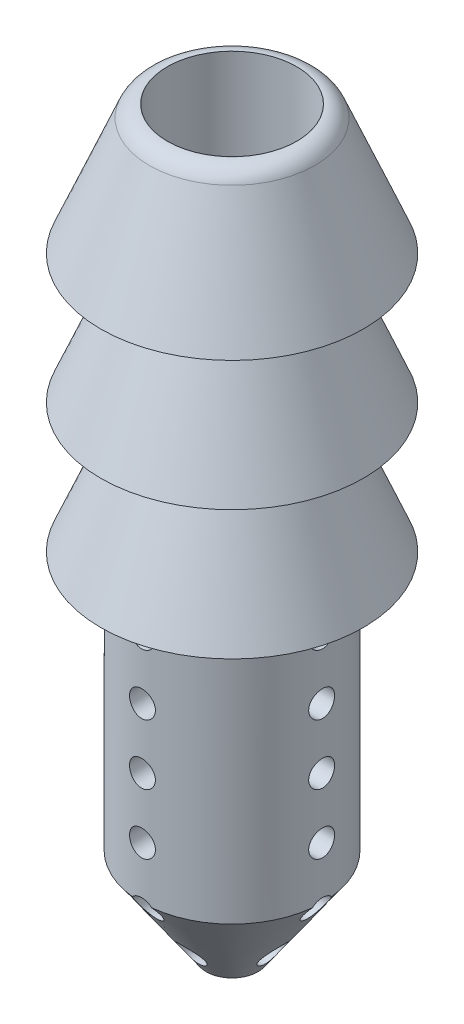
from build123d import *

# Parameters (mm, degrees)
SKETCH1_R                   = 5.08
BOSS_EXTRUDE1_DEPTH         = 5
BOSS_EXTRUDE1_TAPER         = 22.5
LPATTERN1_COUNT             = 3
LPATTERN1_PITCH             = 5
SKETCH3_R                   = 3.5
SKETCH3_R_2                 = 2.5
BOSS_EXTRUDE2_DEPTH         = 10
SKETCH5_R                   = 0.5
CUT_EXTRUDE1_DEPTH          = 27.011781985
LPATTERN2_COUNT             = 7
LPATTERN2_PITCH             = 2.333333333
CIRPATTERN1_COUNT           = 2
CIRPATTERN1_ANGLE           = 90
CIRPATTERN1_COPY_1_SKETCH_R = 0.5
CIRPATTERN1_COPY_1_DEPTH    = 27.011781985
CIRPATTERN1_COPY_2_SKETCH_R = 0.5
CIRPATTERN1_COPY_2_DEPTH    = 27.011781985
CIRPATTERN1_COPY_3_SKETCH_R = 0.5
CIRPATTERN1_COPY_3_DEPTH    = 27.011781985
CIRPATTERN1_COPY_4_SKETCH_R = 0.5
CIRPATTERN1_COPY_4_DEPTH    = 27.011781985
CIRPATTERN1_COPY_5_SKETCH_R = 0.5
CIRPATTERN1_COPY_5_DEPTH    = 27.011781985
CIRPATTERN1_COPY_6_SKETCH_R = 0.5
CIRPATTERN1_COPY_6_DEPTH    = 27.011781985
CUT_EXTRUDE2_START          = -15
SKETCH6_R                   = 2.5
CUT_EXTRUDE2_DEPTH          = 15
SKETCH7_R                   = 1
CUT_EXTRUDE3_DEPTH          = 31.848222121
CHAMFER1_SIZE               = 0.574025149
CHAMFER1_SIZE_2             = 0.75
FILLET1_R                   = 0.75


with BuildPart() as part:
    # Sketch1 → Boss-Extrude1 (new body)
    with BuildSketch(Plane(origin=(0, 0, 0), x_dir=(1, 0, 0), z_dir=(0, 1, 0))):
        Circle(SKETCH1_R)
    boss_extrude1 = extrude(amount=BOSS_EXTRUDE1_DEPTH, taper=BOSS_EXTRUDE1_TAPER)

    # LPattern1: Boss-Extrude1 ×3
    with Locations(*[(0, -i * LPATTERN1_PITCH, 0) for i in range(1, LPATTERN1_COUNT)]):
        add(boss_extrude1)

    # Sketch3 → Boss-Extrude2 (add)
    with BuildSketch(Plane.XZ.offset(10)):
        with Locations(Location((0, 0, 0), (0, 0, 90))):
            Circle(SKETCH3_R)
        with Locations(Location((0, 0, 0), (0, 0, 270))):
            Circle(SKETCH3_R_2, mode=Mode.SUBTRACT)
    extrude(amount=BOSS_EXTRUDE2_DEPTH)

    # Sketch4 → Revolve2 (revolve)
    with BuildSketch(Plane(origin=(0, 0, 0), x_dir=(0, 0, -1), z_dir=(1, 0, 0))):
        Polygon((-2.5, -20), (-3.5, -20), (0, -25), (0, -23.571428571), align=None)
    revolve(axis=Axis((0, 0, 0), (0, 1, 0)))

    # Sketch5 → Cut-Extrude1 (cut, symmetric)
    with BuildSketch(Plane.XY):
        with Locations((0, -11)):
            Circle(SKETCH5_R)
    cut_extrude1 = extrude(amount=CUT_EXTRUDE1_DEPTH, both=True, mode=Mode.SUBTRACT)

    # LPattern2: Cut-Extrude1 ×7
    with Locations(*[(0, -i * LPATTERN2_PITCH, 0) for i in range(1, LPATTERN2_COUNT)]):
        add(cut_extrude1, mode=Mode.SUBTRACT)

    # CirPattern1: Cut-Extrude1 ×2 about axis
    cirpattern1_axis = Axis((0, 0, 0), (0, 1, 0))
    for i in range(1, CIRPATTERN1_COUNT):
        add(cut_extrude1.rotate(cirpattern1_axis, i * CIRPATTERN1_ANGLE / (CIRPATTERN1_COUNT - 1)), mode=Mode.SUBTRACT)

    # CirPattern1 copy 1 sketch → CirPattern1 copy 1 (cut, symmetric)
    with BuildSketch(Plane(origin=(0, -2.333333333, 0), x_dir=(0, 0, -1), z_dir=(1, 0, 0))):
        with Locations((0, -11)):
            Circle(CIRPATTERN1_COPY_1_SKETCH_R)
    extrude(amount=CIRPATTERN1_COPY_1_DEPTH, both=True, mode=Mode.SUBTRACT)

    # CirPattern1 copy 2 sketch → CirPattern1 copy 2 (cut, symmetric)
    with BuildSketch(Plane(origin=(0, -4.666666667, 0), x_dir=(0, 0, -1), z_dir=(1, 0, 0))):
        with Locations((0, -11)):
            Circle(CIRPATTERN1_COPY_2_SKETCH_R)
    extrude(amount=CIRPATTERN1_COPY_2_DEPTH, both=True, mode=Mode.SUBTRACT)

    # CirPattern1 copy 3 sketch → CirPattern1 copy 3 (cut, symmetric)
    with BuildSketch(Plane(origin=(0, -7, 0), x_dir=(0, 0, -1), z_dir=(1, 0, 0))):
        with Locations((0, -11)):
            Circle(CIRPATTERN1_COPY_3_SKETCH_R)
    extrude(amount=CIRPATTERN1_COPY_3_DEPTH, both=True, mode=Mode.SUBTRACT)

    # CirPattern1 copy 4 sketch → CirPattern1 copy 4 (cut, symmetric)
    with BuildSketch(Plane(origin=(0, -9.333333333, 0), x_dir=(0, 0, -1), z_dir=(1, 0, 0))):
        with Locations((0, -11)):
            Circle(CIRPATTERN1_COPY_4_SKETCH_R)
    extrude(amount=CIRPATTERN1_COPY_4_DEPTH, both=True, mode=Mode.SUBTRACT)

    # CirPattern1 copy 5 sketch → CirPattern1 copy 5 (cut, symmetric)
    with BuildSketch(Plane(origin=(0, -11.666666667, 0), x_dir=(0, 0, -1), z_dir=(1, 0, 0))):
        with Locations((0, -11)):
            Circle(CIRPATTERN1_COPY_5_SKETCH_R)
    extrude(amount=CIRPATTERN1_COPY_5_DEPTH, both=True, mode=Mode.SUBTRACT)

    # CirPattern1 copy 6 sketch → CirPattern1 copy 6 (cut, symmetric)
    with BuildSketch(Plane(origin=(0, -14, 0), x_dir=(0, 0, -1), z_dir=(1, 0, 0))):
        with Locations((0, -11)):
            Circle(CIRPATTERN1_COPY_6_SKETCH_R)
    extrude(amount=CIRPATTERN1_COPY_6_DEPTH, both=True, mode=Mode.SUBTRACT)

    # Sketch6 → Cut-Extrude2 (cut)
    with BuildSketch(Plane.XZ.offset(10).offset(CUT_EXTRUDE2_START)):
        with Locations(Location((0, 0, 0), (0, 0, 90))):
            Circle(SKETCH6_R)
    extrude(amount=CUT_EXTRUDE2_DEPTH, mode=Mode.SUBTRACT)

    # Sketch7 → Cut-Extrude3 (cut, through all)
    with BuildSketch(Plane(origin=(0, -25, 0), x_dir=(1, 0, 0), z_dir=(0, 1, 0))):
        with Locations(Location((0, 0, 0), (0, 0, 270))):
            Circle(SKETCH7_R)
    extrude(amount=CUT_EXTRUDE3_DEPTH, mode=Mode.SUBTRACT)

    # Chamfer1
    # the kernel refuses this chamfer: 0.75, 0.574025149 mm, written as the material it adds along each edge
    with BuildSketch(Plane(origin=(0, 0, 0), x_dir=(1, 0, 0), z_dir=(0, 0, -1))) as chamfer1_piece_1:
        Polygon((3.008932188 + CHAMFER1_SIZE, 0), (3.008932188 + CHAMFER1_SIZE_2 * 0.382683432365, CHAMFER1_SIZE_2 * 0.923879532511), (3.008932188, 0), align=None)
    revolve(axis=Axis((0, 0, 0), (0, -1, 0)))
    with BuildSketch(Plane(origin=(0, -10, 0), x_dir=(0, 0, 1), z_dir=(1, 0, 0))) as chamfer1_piece_2_section:
        Polygon((3.5, CHAMFER1_SIZE_2), (3.5 + CHAMFER1_SIZE_2, 0), (3.5, 0), align=None)
    chamfer1_piece_2 = revolve(axis=Axis((0, -10, 0), (0, -1, 0)), mode=Mode.PRIVATE)
    chamfer1_piece_2 = chamfer1_piece_2 - Plane(origin=(0, -11, -3.861342419), x_dir=(1, 0, 0), z_dir=(0, 0, 1)) * Cylinder(0.5, 17, mode=Mode.PRIVATE)
    chamfer1_piece_2 = chamfer1_piece_2 - Plane(origin=(0, -11, 0), x_dir=(0, 0, -1), z_dir=(1, 0, 0)) * Cylinder(0.5, 17, mode=Mode.PRIVATE)
    add(chamfer1_piece_2)
    with BuildSketch(Plane(origin=(0, -5, 0), x_dir=(1, 0, 0), z_dir=(0, 0, -1))) as chamfer1_piece_3:
        Polygon((3.008932188 + CHAMFER1_SIZE, 0), (3.008932188 + CHAMFER1_SIZE_2 * 0.382683432365, CHAMFER1_SIZE_2 * 0.923879532511), (3.008932188, 0), align=None)
    revolve(axis=Axis((0, -5, 0), (0, -1, 0)))

    # Fillet1
    fillet1_edges = [part.edges().sort_by_distance(p)[0] for p in [
        (-3.008932188, 5, 0),
    ]]
    fillet(fillet1_edges, radius=FILLET1_R)


solid = part.part
